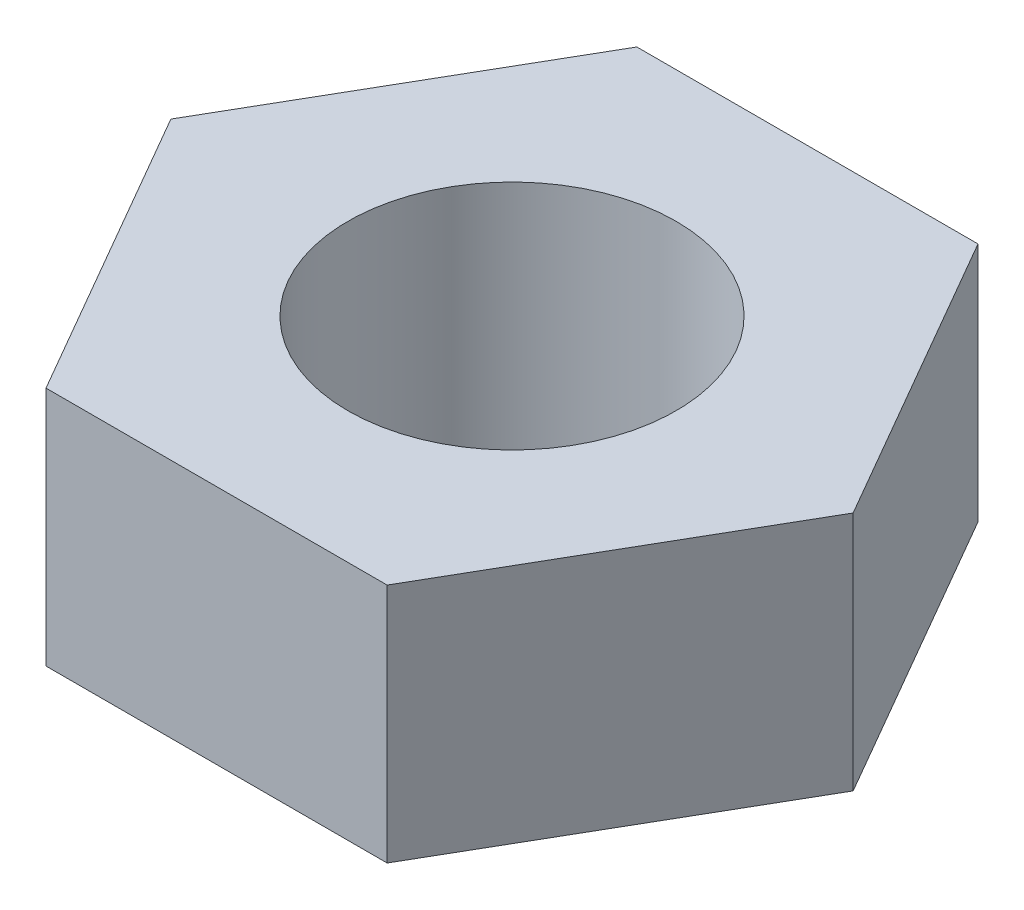
from build123d import *

# Parameters (mm, degrees)
CROQUIS1_R              = 1.5
SALIENTE_EXTRUIR1_DEPTH = 2.2


with BuildPart() as part:
    # Croquis1 → Saliente-Extruir1 (new body)
    with BuildSketch(Plane(origin=(0, 0, 0), x_dir=(1, 0, 0), z_dir=(0, 1, 0))):
        Polygon((3.117691454, 0), (1.558845727, 2.7), (-1.558845727, 2.7), (-3.117691454, 0), (-1.558845727, -2.7), (1.558845727, -2.7), align=None)
        Circle(CROQUIS1_R, mode=Mode.SUBTRACT)
    extrude(amount=SALIENTE_EXTRUIR1_DEPTH)


solid = part.part
